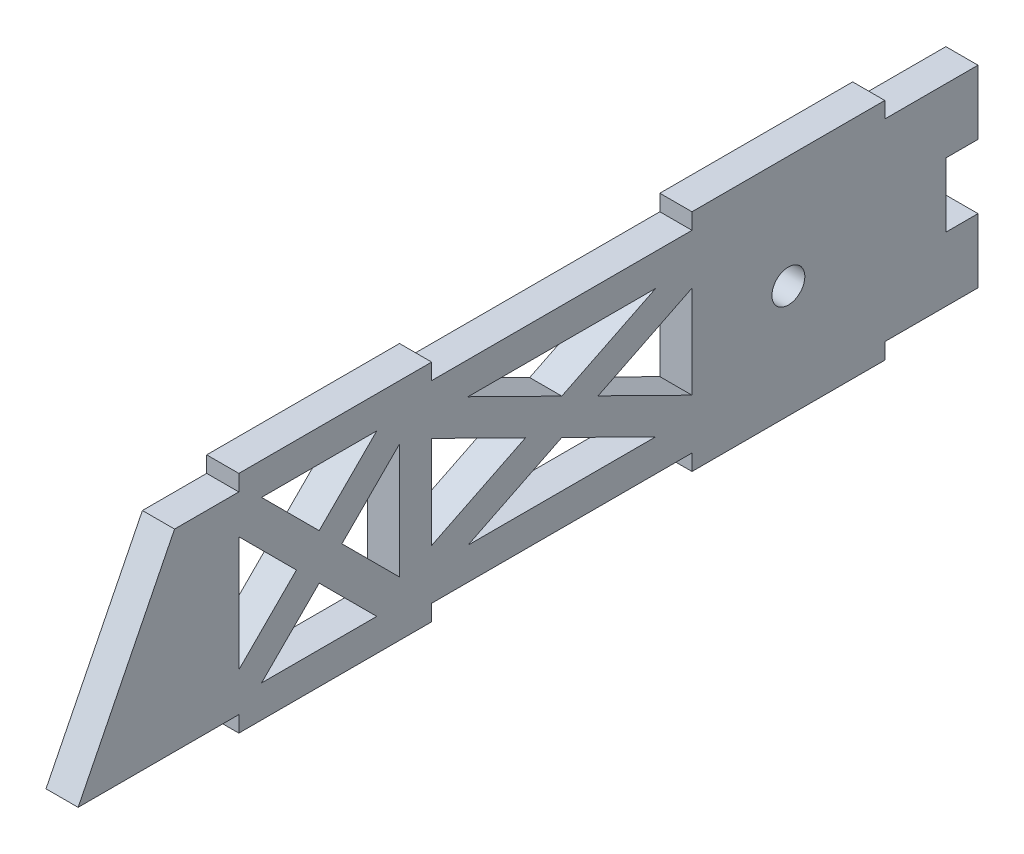
from build123d import *

# Parameters (mm, degrees)
SKETCH1_W               = 355.6
SKETCH1_H               = 76.2
BOSS_EXTRUDE1_DEPTH     = 12.7
CUT_EXTRUDE1_DEPTH      = 183.279291199
CUT_EXTRUDE1_DEPTH_BACK = 183.279291199
SKETCH3_W               = 76.2
SKETCH3_H               = 6.35
BOSS_EXTRUDE2_DEPTH     = 12.7
SKETCH4_W               = 12.7
SKETCH4_H               = 25.4
CUT_EXTRUDE2_DEPTH      = 184.711546997
SKETCH5_R               = 6.5
CUT_EXTRUDE3_DEPTH      = 184.711546997
CUT_EXTRUDE4_DEPTH      = 184.711546997


with BuildPart() as part:
    # Sketch1 → Boss-Extrude1 (new body)
    with BuildSketch(Plane(origin=(0, 0, 0), x_dir=(0, 0, -1), z_dir=(1, 0, 0))):
        Rectangle(SKETCH1_W, SKETCH1_H)
    extrude(amount=BOSS_EXTRUDE1_DEPTH)

    # Sketch2 → Cut-Extrude1 (cut, two sides: drawn at the far end of the back side and taken through both)
    with BuildSketch(Plane(origin=(12.7, 0, 0), x_dir=(0, 0, -1), z_dir=(1, 0, 0)).offset(-CUT_EXTRUDE1_DEPTH_BACK)):
        Polygon((-507.550847217, -697.601694433), (-177.8, -38.1), (-139.7, 38.1), (190.050847217, 697.601694433), (-1128.95254165, 1357.103388866), (-1826.554236083, -38.1), align=None)
    extrude(amount=CUT_EXTRUDE1_DEPTH + CUT_EXTRUDE1_DEPTH_BACK, mode=Mode.SUBTRACT)

    # Sketch3 → Boss-Extrude2 (add)
    with BuildSketch(Plane.ZY):
        with Locations((-102.87, -41.275)):
            Rectangle(SKETCH3_W, SKETCH3_H)
        with Locations((76.2, -41.275)):
            Rectangle(SKETCH3_W, SKETCH3_H)
        with Locations((-102.87, 41.275)):
            Rectangle(SKETCH3_W, SKETCH3_H)
        with Locations((76.2, 41.275)):
            Rectangle(SKETCH3_W, SKETCH3_H)
    extrude(amount=-BOSS_EXTRUDE2_DEPTH)

    # Sketch4 → Cut-Extrude2 (cut, through all)
    with BuildSketch(Plane.ZY):
        with Locations((-171.45, 0)):
            Rectangle(SKETCH4_W, SKETCH4_H)
    extrude(amount=-CUT_EXTRUDE2_DEPTH, mode=Mode.SUBTRACT)

    # Sketch5 → Cut-Extrude3 (cut, through all)
    with BuildSketch(Plane.ZY):
        with Locations((-102.87, 0)):
            Circle(SKETCH5_R)
    extrude(amount=-CUT_EXTRUDE3_DEPTH, mode=Mode.SUBTRACT)

    # Sketch6 → Cut-Extrude4 (cut, through all)
    with BuildSketch(Plane.ZY):
        Polygon((23.758802297, 25.4), (-50.428802297, 25.4), (-13.335, 7.08207294), align=None)
        Polygon((-27.676197703, 0), (-64.77, 18.31792706), (-64.77, -18.31792706), align=None)
        Polygon((38.1, -18.31792706), (38.1, 18.31792706), (1.006197703, 0), align=None)
        Polygon((-13.335, -7.08207294), (-50.428802297, -25.4), (23.758802297, -25.4), align=None)
        Polygon((105.319743879, 31.75), (59.780256121, 31.75), (82.55, 8.980256121), align=None)
        Polygon((73.569743879, 0), (50.8, 22.769743879), (50.8, -22.769743879), align=None)
        Polygon((114.3, 22.769743879), (91.530256121, 0), (114.3, -22.769743879), align=None)
        Polygon((105.319743879, -31.75), (82.55, -8.980256121), (59.780256121, -31.75), align=None)
    extrude(amount=-CUT_EXTRUDE4_DEPTH, mode=Mode.SUBTRACT)


solid = part.part
